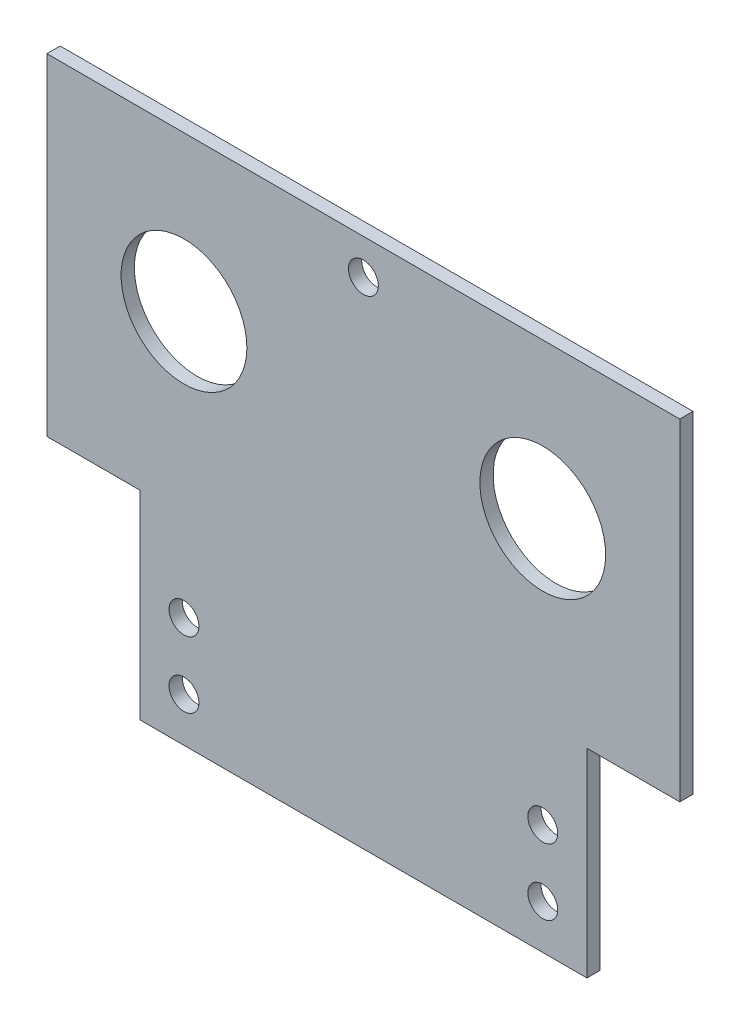
from build123d import *

# Parameters (mm, degrees)
SKETCH1_W           = 143.16
SKETCH1_H           = 120
BOSS_EXTRUDE1_DEPTH = 3
SKETCH2_R           = 14.225
SKETCH2_R_2         = 3.375
CUT_EXTRUDE1_DEPTH  = 187.825548574
SKETCH3_W           = 21
SKETCH3_H           = 45
CUT_EXTRUDE2_DEPTH  = 187.825548574


with BuildPart() as part:
    # Sketch1 → Boss-Extrude1 (new body)
    with BuildSketch(Plane.XY):
        with Locations((71.58, -60)):
            Rectangle(SKETCH1_W, SKETCH1_H)
    extrude(amount=BOSS_EXTRUDE1_DEPTH)

    # Sketch2 → Cut-Extrude1 (cut, through all)
    with BuildSketch(Plane.XY.offset(3)):
        with Locations((31, -35)):
            Circle(SKETCH2_R)
        with Locations((112.16, -35)):
            Circle(SKETCH2_R)
        with Locations((31, -110)):
            Circle(SKETCH2_R_2)
        with Locations((112.16, -110)):
            Circle(SKETCH2_R_2)
        with Locations((71.58, -8)):
            Circle(SKETCH2_R_2)
        with Locations((31, -95)):
            Circle(SKETCH2_R_2)
        with Locations((112.16, -95)):
            Circle(SKETCH2_R_2)
    extrude(amount=-CUT_EXTRUDE1_DEPTH, mode=Mode.SUBTRACT)

    # Sketch3 → Cut-Extrude2 (cut, through all)
    with BuildSketch(Plane(origin=(0, 0, 0), x_dir=(-1, 0, 0), z_dir=(0, 0, -1))):
        with Locations((-10.5, -97.5)):
            Rectangle(SKETCH3_W, SKETCH3_H)
        with Locations((-132.66, -97.5)):
            Rectangle(SKETCH3_W, SKETCH3_H)
    extrude(amount=-CUT_EXTRUDE2_DEPTH, mode=Mode.SUBTRACT)


solid = part.part
